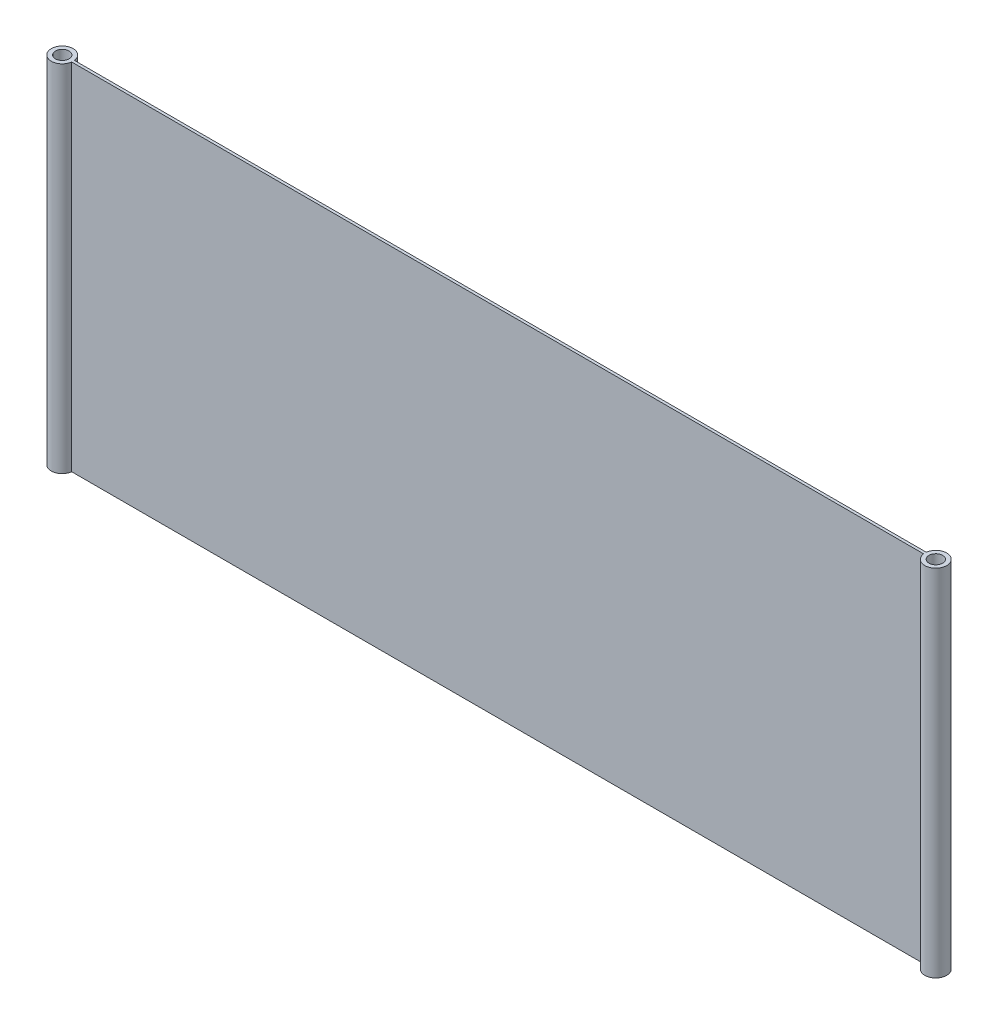
from build123d import *

# Parameters (mm, degrees)
CROQUIS2_R              = 1.25
SALIENTE_EXTRUIR2_DEPTH = 65


with BuildPart() as part:
    # Croquis2 → Saliente-Extruir2 (new body)
    with BuildSketch(Plane(origin=(0, 0, 0), x_dir=(1, 0, 0), z_dir=(0, 1, 0))):
        with BuildLine():
            Line((-78.012853295, 0.25), (78.012853295, 0.25))
            ThreePointArc((78.012853295, 0.25), (82.002811031, 0), (78.012853295, -0.25))
            Line((78.012853295, -0.25), (-78.012853295, -0.25))
            ThreePointArc((-78.012853295, -0.25), (-82.002811031, 0), (-78.012853295, 0.25))
        make_face()
        with Locations((-80, 0)):
            Circle(CROQUIS2_R, mode=Mode.SUBTRACT)
        with Locations((80, 0)):
            Circle(CROQUIS2_R, mode=Mode.SUBTRACT)
    extrude(amount=SALIENTE_EXTRUIR2_DEPTH)


solid = part.part
